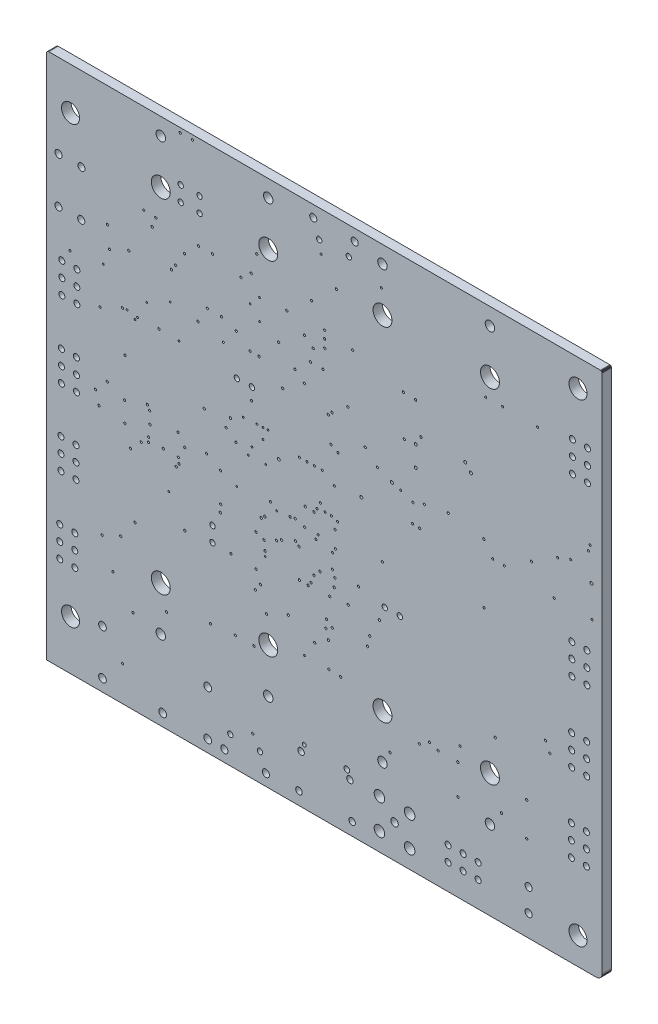
from build123d import *

# Parameters (mm, degrees)
BOARD_OUTLINE_DEPTH = 1.6
SKETCH2_R           = 0.325
SKETCH2_R_2         = 0.475
SKETCH2_R_3         = 1.6
SKETCH2_R_4         = 0.1905
SKETCH2_R_5         = 0.15
SKETCH2_R_6         = 0.175
SKETCH2_R_7         = 0.25
SKETCH2_R_8         = 1.524
SKETCH2_R_9         = 0.2
NPTH_DEPTH          = 131.561985758
SKETCH3_R           = 0.45
SKETCH3_R_2         = 0.6
SKETCH3_R_3         = 0.55
SKETCH3_R_4         = 0.635
SKETCH3_R_5         = 0.89
SKETCH3_R_6         = 0.8
SKETCH3_R_7         = 0.51
SKETCH3_R_8         = 0.455
SKETCH3_R_9         = 0.65
PTH_DEPTH           = 131.561985758


with BuildPart() as part:
    # Sketch1 → Board_Outline (new body)
    with BuildSketch(Plane.XY):
        Polygon((-94.885, 89.235556), (-94.885, 0.5), (-2.007153, 0.5), (-1.746483, 0.534318), (-1.503577, 0.634933), (-1.294988, 0.794988), (-1.134933, 1.003577), (-1.034318, 1.246483), (-1, 1.507153), (-1, 89.345834), (-1.011046, 89.429735), (-1.04343, 89.507917), (-1.094946, 89.575054), (-1.162083, 89.62657), (-1.240265, 89.658954), (-1.324166, 89.67), (-94.450556, 89.67), (-94.562999, 89.655197), (-94.667778, 89.611796), (-94.757754, 89.542754), (-94.826796, 89.452778), (-94.870197, 89.347999), align=None)
    extrude(amount=BOARD_OUTLINE_DEPTH)

    # Sketch2 → NPTH (cut, through all)
    with BuildSketch(Plane.XY):
        with Locations((-51.3266, 9.8552)):
            Circle(SKETCH2_R)
        with Locations((-44.1266, 9.8552)):
            Circle(SKETCH2_R_2)
        with Locations((-19.9502, 21.4054)):
            Circle(SKETCH2_R_3)
        with Locations((-38.1052, 21.4054)):
            Circle(SKETCH2_R_3)
        with Locations((-57.4052, 21.4054)):
            Circle(SKETCH2_R_3)
        with Locations((-19.9502, 79.3154)):
            Circle(SKETCH2_R_3)
        with Locations((-75.5602, 21.4054)):
            Circle(SKETCH2_R_3)
        with Locations((-75.5602, 79.3154)):
            Circle(SKETCH2_R_3)
        with Locations((-38.1052, 79.3154)):
            Circle(SKETCH2_R_3)
        with Locations((-57.4052, 79.3154)):
            Circle(SKETCH2_R_3)
        with Locations((-59.5884, 28.3718)):
            Circle(SKETCH2_R_4)
        with Locations((-31.877, 19.7104)):
            Circle(SKETCH2_R_4)
        with Locations((-46.5582, 37.8968)):
            Circle(SKETCH2_R_4)
        with Locations((-57.8104, 47.5991)):
            Circle(SKETCH2_R_5)
        with Locations((-49.1683, 45.466)):
            Circle(SKETCH2_R_4)
        with Locations((-38.9636, 56.6166)):
            Circle(SKETCH2_R_4)
        with Locations((-47.1678, 22.9616)):
            Circle(SKETCH2_R_4)
        with Locations((-47.5488, 30.099)):
            Circle(SKETCH2_R_4)
        with Locations((-36.83, 15.9512)):
            Circle(SKETCH2_R_4)
        with Locations((-46.8249, 56.0324)):
            Circle(SKETCH2_R_4)
        with Locations((-60.2742, 74.3458)):
            Circle(SKETCH2_R_4)
        with Locations((-55.6514, 66.5734)):
            Circle(SKETCH2_R_4)
        with Locations((-80.9752, 67.31)):
            Circle(SKETCH2_R_4)
        with Locations((-58.7069, 29.591)):
            Circle(SKETCH2_R_4)
        with Locations((-62.865, 48.3362)):
            Circle(SKETCH2_R_4)
        with Locations((-65.4812, 42.9006)):
            Circle(SKETCH2_R_4)
        with Locations((-55.9877, 41.7383)):
            Circle(SKETCH2_R_5)
        with Locations((-57.912, 34.0868)):
            Circle(SKETCH2_R_5)
        with Locations((-60.1472, 48.9924)):
            Circle(SKETCH2_R_5)
        with Locations((-61.6148, 52.609)):
            Circle(SKETCH2_R_5)
        with Locations((-17.8054, 76.073)):
            Circle(SKETCH2_R_6)
        with Locations((-78.4352, 74.4982)):
            Circle(SKETCH2_R_6)
        with Locations((-45.6184, 55.4228)):
            Circle(SKETCH2_R_6)
        with Locations((-36.5252, 55.626)):
            Circle(SKETCH2_R_7)
        with Locations((-55.626, 49.4792)):
            Circle(SKETCH2_R_7)
        with Locations((-13.7414, 14.8844)):
            Circle(SKETCH2_R_4)
        with Locations((-13.7414, 20.574)):
            Circle(SKETCH2_R_4)
        with Locations((-43.1419, 71.6788)):
            Circle(SKETCH2_R_4)
        with Locations((-19.05, 27.051)):
            Circle(SKETCH2_R_4)
        with Locations((-32.4866, 59.7916)):
            Circle(SKETCH2_R_7)
        with Locations((-48.6664, 36.5252)):
            Circle(SKETCH2_R_4)
        with Locations((-51.2499, 41.7249)):
            Circle(SKETCH2_R_4)
        with Locations((-54.9656, 60.1726)):
            Circle(SKETCH2_R_4)
        with Locations((-47.2694, 60.1726)):
            Circle(SKETCH2_R_4)
        with Locations((-49.3268, 40.894)):
            Circle(SKETCH2_R_6)
        with Locations((-46.5582, 40.3352)):
            Circle(SKETCH2_R_6)
        with Locations((-67.1576, 19.6342)):
            Circle(SKETCH2_R_4)
        with Locations((-49.5554, 25.654)):
            Circle(SKETCH2_R_4)
        with Locations((-46.5836, 29.3116)):
            Circle(SKETCH2_R_4)
        with Locations((-47.0154, 33.7058)):
            Circle(SKETCH2_R_4)
        with Locations((-49.6824, 35.4584)):
            Circle(SKETCH2_R_4)
        with Locations((-78.867, 40.3606)):
            Circle(SKETCH2_R_4)
        with Locations((-9.0932, 52.4256)):
            Circle(SKETCH2_R_6)
        with Locations((-2.7178, 52.451)):
            Circle(SKETCH2_R_6)
        with Locations((-72.4789, 40.3733)):
            Circle(SKETCH2_R_4)
        with Locations((-52.853, 42.1723)):
            Circle(SKETCH2_R_4)
        with Locations((-53.7083, 41.9989)):
            Circle(SKETCH2_R_4)
        with Locations((-72.9488, 39.7129)):
            Circle(SKETCH2_R_4)
        with Locations((-77.4087, 43.6702)):
            Circle(SKETCH2_R_4)
        with Locations((-86.0066, 42.1242)):
            Circle(SKETCH2_R_4)
        with Locations((-86.5976, 44.1802)):
            Circle(SKETCH2_R_4)
        with Locations((-75.8698, 58.42)):
            Circle(SKETCH2_R_4)
        with Locations((-73.0504, 69.1388)):
            Circle(SKETCH2_R_4)
        with Locations((-50.292, 66.3702)):
            Circle(SKETCH2_R_4)
        with Locations((-51.2826, 69.7738)):
            Circle(SKETCH2_R_4)
        with Locations((-80.6704, 38.5318)):
            Circle(SKETCH2_R_4)
        with Locations((-85.471, 23.4442)):
            Circle(SKETCH2_R_4)
        with Locations((-74.5998, 17.6276)):
            Circle(SKETCH2_R_4)
        with Locations((-24.9936, 22.8092)):
            Circle(SKETCH2_R_4)
        with Locations((-12.9286, 55.8546)):
            Circle(SKETCH2_R_4)
        with Locations((-27.0002, 55.9054)):
            Circle(SKETCH2_R_4)
        with Locations((-18.0086, 16.51)):
            Circle(SKETCH2_R_4)
        with Locations((-25.3492, 15.1892)):
            Circle(SKETCH2_R_4)
        with Locations((-57.9374, 34.8996)):
            Circle(SKETCH2_R_4)
        with Locations((-57.023, 42.545)):
            Circle(SKETCH2_R_4)
        with Locations((-52.1462, 33.528)):
            Circle(SKETCH2_R_4)
        with Locations((-43.8912, 34.036)):
            Circle(SKETCH2_R_4)
        with Locations((-40.259, 31.2928)):
            Circle(SKETCH2_R_4)
        with Locations((-40.64, 29.591)):
            Circle(SKETCH2_R_4)
        with Locations((-38.6334, 34.4424)):
            Circle(SKETCH2_R_4)
        with Locations((-42.1386, 37.592)):
            Circle(SKETCH2_R_4)
        with Locations((-65.4304, 37.973)):
            Circle(SKETCH2_R_4)
        with Locations((-65.5066, 36.7284)):
            Circle(SKETCH2_R_4)
        with Locations((-49.6697, 44.7294)):
            Circle(SKETCH2_R_4)
        with Locations((-60.0202, 7.1247)):
            Circle(SKETCH2_R_4)
        with Locations((-82.3214, 24.8412)):
            Circle(SKETCH2_R_4)
        with Locations((-81.5975, 51.7017)):
            Circle(SKETCH2_R_4)
        with Locations((-85.8139, 56.6293)):
            Circle(SKETCH2_R_4)
        with Locations((-85.2765, 63.1828)):
            Circle(SKETCH2_R_5)
        with Locations((-84.2264, 65.8876)):
            Circle(SKETCH2_R_4)
        with Locations((-69.1896, 73.9013)):
            Circle(SKETCH2_R_4)
        with Locations((-66.8274, 73.9013)):
            Circle(SKETCH2_R_4)
        with Locations((-67.691, 65.5066)):
            Circle(SKETCH2_R_4)
        with Locations((-65.3161, 65.4812)):
            Circle(SKETCH2_R_4)
        with Locations((-62.8142, 64.6303)):
            Circle(SKETCH2_R_4)
        with Locations((-60.4774, 62.865)):
            Circle(SKETCH2_R_4)
        with Locations((-58.9534, 62.8523)):
            Circle(SKETCH2_R_4)
        with Locations((-32.512, 69.723)):
            Circle(SKETCH2_R_4)
        with Locations((-34.5694, 69.8119)):
            Circle(SKETCH2_R_4)
        with Locations((-47.879, 70.9549)):
            Circle(SKETCH2_R_4)
        with Locations((-47.879, 72.2249)):
            Circle(SKETCH2_R_4)
        with Locations((-47.8536, 69.5833)):
            Circle(SKETCH2_R_4)
        with Locations((-49.8094, 68.6181)):
            Circle(SKETCH2_R_4)
        with Locations((-58.8899, 71.5137)):
            Circle(SKETCH2_R_5)
        with Locations((-58.8645, 67.9831)):
            Circle(SKETCH2_R_5)
        with Locations((-60.4647, 69.7992)):
            Circle(SKETCH2_R_5)
        with Locations((-59.3471, 77.6478)):
            Circle(SKETCH2_R_4)
        with Locations((-62.0268, 72.8853)):
            Circle(SKETCH2_R_4)
        with Locations((-41.021, 58.5343)):
            Circle(SKETCH2_R_4)
        with Locations((-52.8955, 64.008)):
            Circle(SKETCH2_R_4)
        with Locations((-51.308, 62.7253)):
            Circle(SKETCH2_R_4)
        with Locations((-67.818, 44.196)):
            Circle(SKETCH2_R_4)
        with Locations((-47.6758, 28.702)):
            Circle(SKETCH2_R_4)
        with Locations((-72.644, 44.9072)):
            Circle(SKETCH2_R_4)
        with Locations((-72.5932, 41.275)):
            Circle(SKETCH2_R_4)
        with Locations((-75.1332, 41.275)):
            Circle(SKETCH2_R_4)
        with Locations((-81.6864, 45.085)):
            Circle(SKETCH2_R_4)
        with Locations((-81.6356, 41.7068)):
            Circle(SKETCH2_R_4)
        with Locations((-76.4032, 74.422)):
            Circle(SKETCH2_R_4)
        with Locations((-45.8978, 79.2226)):
            Circle(SKETCH2_R_4)
        with Locations((-50.0888, 75.438)):
            Circle(SKETCH2_R_4)
        with Locations((-90.805, 82.55)):
            Circle(SKETCH2_R_8)
        with Locations((-90.805, 8.89)):
            Circle(SKETCH2_R_8)
        with Locations((-5.08, 5.08)):
            Circle(SKETCH2_R_8)
        with Locations((-5.08, 85.09)):
            Circle(SKETCH2_R_8)
        with Locations((-59.4614, 31.4706)):
            Circle(SKETCH2_R_4)
        with Locations((-63.7032, 31.5976)):
            Circle(SKETCH2_R_4)
        with Locations((-57.7088, 25.8064)):
            Circle(SKETCH2_R_4)
        with Locations((-54.0258, 27.4828)):
            Circle(SKETCH2_R_4)
        with Locations((-60.2234, 55.7276)):
            Circle(SKETCH2_R_4)
        with Locations((-63.8048, 51.4096)):
            Circle(SKETCH2_R_4)
        with Locations((-64.516, 49.6316)):
            Circle(SKETCH2_R_4)
        with Locations((-79.4849, 58.2847)):
            Circle(SKETCH2_R_5)
        with Locations((-81.2697, 58.5147)):
            Circle(SKETCH2_R_5)
        with Locations((-73.9648, 63.2968)):
            Circle(SKETCH2_R_5)
        with Locations((-74.1934, 35.4584)):
            Circle(SKETCH2_R_5)
        with Locations((-58.293, 51.0286)):
            Circle(SKETCH2_R_5)
        with Locations((-57.4548, 52.832)):
            Circle(SKETCH2_R_5)
        with Locations((-59.309, 52.7558)):
            Circle(SKETCH2_R_5)
        with Locations((-58.293, 52.7812)):
            Circle(SKETCH2_R_5)
        with Locations((-51.2826, 22.9362)):
            Circle(SKETCH2_R_5)
        with Locations((-60.7822, 47.498)):
            Circle(SKETCH2_R_5)
        with Locations((-62.7126, 41.9354)):
            Circle(SKETCH2_R_5)
        with Locations((-77.9272, 61.2394)):
            Circle(SKETCH2_R_5)
        with Locations((-72.2757, 88.9)):
            Circle(SKETCH2_R_4)
        with Locations((-70.2183, 88.9)):
            Circle(SKETCH2_R_4)
        with Locations((-48.4632, 83.0326)):
            Circle(SKETCH2_R_6)
        with Locations((-68.2244, 50.5714)):
            Circle(SKETCH2_R_9)
        with Locations((-3.0226, 63.2206)):
            Circle(SKETCH2_R_6)
        with Locations((-11.9126, 76.0222)):
            Circle(SKETCH2_R_6)
        with Locations((-2.794, 57.7342)):
            Circle(SKETCH2_R_7)
        with Locations((-32.4866, 63.2206)):
            Circle(SKETCH2_R_7)
        with Locations((-23.1648, 63.7032)):
            Circle(SKETCH2_R_7)
        with Locations((-41.6814, 50.8762)):
            Circle(SKETCH2_R_7)
        with Locations((-71.5518, 71.5772)):
            Circle(SKETCH2_R_4)
        with Locations((-69.2912, 62.7888)):
            Circle(SKETCH2_R_4)
        with Locations((-46.0502, 41.148)):
            Circle(SKETCH2_R_4)
        with Locations((-48.9712, 41.7322)):
            Circle(SKETCH2_R_6)
        with Locations((-45.6946, 45.3136)):
            Circle(SKETCH2_R_6)
        with Locations((-48.2854, 51.5366)):
            Circle(SKETCH2_R_6)
        with Locations((-46.736, 45.6438)):
            Circle(SKETCH2_R_6)
        with Locations((-49.6062, 51.5112)):
            Circle(SKETCH2_R_6)
        with Locations((-47.8028, 45.6692)):
            Circle(SKETCH2_R_6)
        with Locations((-50.8508, 51.4858)):
            Circle(SKETCH2_R_6)
        with Locations((-48.5902, 46.5836)):
            Circle(SKETCH2_R_6)
        with Locations((-52.1208, 51.4858)):
            Circle(SKETCH2_R_6)
        with Locations((-57.9882, 39.9034)):
            Circle(SKETCH2_R_4)
        with Locations((-77.8256, 46.355)):
            Circle(SKETCH2_R_4)
        with Locations((-58.5978, 39.3954)):
            Circle(SKETCH2_R_4)
        with Locations((-77.4446, 45.6692)):
            Circle(SKETCH2_R_4)
        with Locations((-55.1434, 37.8968)):
            Circle(SKETCH2_R_4)
        with Locations((-8.509, 58.6232)):
            Circle(SKETCH2_R_6)
        with Locations((-56.007, 37.4015)):
            Circle(SKETCH2_R_4)
        with Locations((-6.2992, 59.4614)):
            Circle(SKETCH2_R_6)
        with Locations((-59.4614, 36.9062)):
            Circle(SKETCH2_R_4)
        with Locations((-77.6371, 40.9448)):
            Circle(SKETCH2_R_4)
        with Locations((-58.1406, 36.3982)):
            Circle(SKETCH2_R_4)
        with Locations((-77.6224, 41.7068)):
            Circle(SKETCH2_R_4)
        with Locations((-46.1518, 36.8554)):
            Circle(SKETCH2_R_4)
        with Locations((-84.6074, 46.3296)):
            Circle(SKETCH2_R_4)
        with Locations((-79.9084, 57.7596)):
            Circle(SKETCH2_R_5)
        with Locations((-82.0166, 58.3946)):
            Circle(SKETCH2_R_4)
        with Locations((-38.3032, 83.2104)):
            Circle(SKETCH2_R_6)
        with Locations((-71.5137, 31.0896)):
            Circle(SKETCH2_R_4)
        with Locations((-46.2534, 35.4076)):
            Circle(SKETCH2_R_4)
        with Locations((-30.1752, 20.7899)):
            Circle(SKETCH2_R_4)
        with Locations((-28.702, 20.2946)):
            Circle(SKETCH2_R_4)
        with Locations((-25.3746, 20.2946)):
            Circle(SKETCH2_R_4)
        with Locations((-9.8298, 29.337)):
            Circle(SKETCH2_R_4)
        with Locations((-52.2224, 38.4175)):
            Circle(SKETCH2_R_4)
        with Locations((-52.8066, 38.9382)):
            Circle(SKETCH2_R_4)
        with Locations((-10.5664, 30.861)):
            Circle(SKETCH2_R_4)
        with Locations((-35.0266, 55.2196)):
            Circle(SKETCH2_R_6)
        with Locations((-46.1264, 43.942)):
            Circle(SKETCH2_R_6)
        with Locations((-33.02, 51.3334)):
            Circle(SKETCH2_R_4)
        with Locations((-32.9692, 54.4957)):
            Circle(SKETCH2_R_4)
        with Locations((-31.8262, 51.2572)):
            Circle(SKETCH2_R_4)
        with Locations((-31.0388, 55.1688)):
            Circle(SKETCH2_R_4)
        with Locations((-20.9804, 55.118)):
            Circle(SKETCH2_R_4)
        with Locations((-20.955, 45.085)):
            Circle(SKETCH2_R_4)
        with Locations((-38.1308, 43.2235)):
            Circle(SKETCH2_R_4)
        with Locations((-51.1603, 44.7929)):
            Circle(SKETCH2_R_4)
        with Locations((-20.6756, 75.9968)):
            Circle(SKETCH2_R_6)
        with Locations((-46.2534, 50.2666)):
            Circle(SKETCH2_R_6)
        with Locations((-19.4818, 52.959)):
            Circle(SKETCH2_R_6)
        with Locations((-17.526, 52.959)):
            Circle(SKETCH2_R_6)
        with Locations((-50.673, 33.5026)):
            Circle(SKETCH2_R_4)
        with Locations((-47.244, 27.2034)):
            Circle(SKETCH2_R_4)
        with Locations((-50.165, 34.1376)):
            Circle(SKETCH2_R_4)
        with Locations((-45.1739, 22.8473)):
            Circle(SKETCH2_R_4)
        with Locations((-82.0166, 6.3754)):
            Circle(SKETCH2_R_4)
        with Locations((-71.501, 43.2562)):
            Circle(SKETCH2_R_4)
        with Locations((-77.0128, 72.771)):
            Circle(SKETCH2_R_4)
        with Locations((-54.2798, 71.882)):
            Circle(SKETCH2_R_4)
        with Locations((-46.6344, 60.8076)):
            Circle(SKETCH2_R_4)
        with Locations((-31.5976, 64.7192)):
            Circle(SKETCH2_R_4)
        with Locations((-72.4916, 58.3438)):
            Circle(SKETCH2_R_5)
        with Locations((-3.3274, 62.23)):
            Circle(SKETCH2_R_6)
        with Locations((-24.13, 64.7954)):
            Circle(SKETCH2_R_7)
        with Locations((-84.582, 69.3166)):
            Circle(SKETCH2_R_4)
        with Locations((-62.9666, 20.0406)):
            Circle(SKETCH2_R_4)
        with Locations((-59.817, 20.0406)):
            Circle(SKETCH2_R_4)
        with Locations((-80.2386, 14.7066)):
            Circle(SKETCH2_R_4)
        with Locations((-83.6422, 18.9992)):
            Circle(SKETCH2_R_4)
        with Locations((-79.9084, 28.067)):
            Circle(SKETCH2_R_4)
        with Locations((-73.7616, 68.1482)):
            Circle(SKETCH2_R_4)
        with Locations((-48.1584, 66.3702)):
            Circle(SKETCH2_R_4)
        with Locations((-90.9066, 62.3316)):
            Circle(SKETCH2_R_4)
        with Locations((-43.9674, 62.9666)):
            Circle(SKETCH2_R_4)
        with Locations((-34.4297, 63.0047)):
            Circle(SKETCH2_R_4)
        with Locations((-64.9986, 61.9252)):
            Circle(SKETCH2_R_6)
    extrude(amount=NPTH_DEPTH, mode=Mode.SUBTRACT)

    # Sketch3 → PTH (cut, through all)
    with BuildSketch(Plane.XY):
        with Locations((-63.81, 5.14)):
            Circle(SKETCH3_R)
        with Locations((-58.81, 5.14)):
            Circle(SKETCH3_R)
        with Locations((-64.81, 2.44)):
            Circle(SKETCH3_R_2)
        with Locations((-57.81, 2.44)):
            Circle(SKETCH3_R_2)
        with Locations((-51.86, 8.61)):
            Circle(SKETCH3_R_3)
        with Locations((-43.6, 8.61)):
            Circle(SKETCH3_R_3)
        with Locations((-52.22, 2.66)):
            Circle(SKETCH3_R_3)
        with Locations((-43.24, 2.66)):
            Circle(SKETCH3_R_3)
        with Locations((-36.07, 6.13)):
            Circle(SKETCH3_R_4)
        with Locations((-38.62, 8.68)):
            Circle(SKETCH3_R_5)
        with Locations((-33.52, 8.68)):
            Circle(SKETCH3_R_5)
        with Locations((-33.52, 3.58)):
            Circle(SKETCH3_R_5)
        with Locations((-38.62, 3.58)):
            Circle(SKETCH3_R_5)
        with Locations((-19.95, 13.91)):
            Circle(SKETCH3_R_6)
        with Locations((-38.11, 13.91)):
            Circle(SKETCH3_R_6)
        with Locations((-57.41, 13.91)):
            Circle(SKETCH3_R_6)
        with Locations((-75.56, 13.91)):
            Circle(SKETCH3_R_6)
        with Locations((-75.56, 86.81)):
            Circle(SKETCH3_R_6)
        with Locations((-57.41, 86.81)):
            Circle(SKETCH3_R_6)
        with Locations((-38.11, 86.81)):
            Circle(SKETCH3_R_6)
        with Locations((-19.95, 86.81)):
            Circle(SKETCH3_R_6)
        with Locations((-92.28, 60.22)):
            Circle(SKETCH3_R_7)
        with Locations((-89.74, 60.22)):
            Circle(SKETCH3_R_7)
        with Locations((-92.28, 57.68)):
            Circle(SKETCH3_R_7)
        with Locations((-89.74, 57.68)):
            Circle(SKETCH3_R_7)
        with Locations((-92.28, 55.14)):
            Circle(SKETCH3_R_7)
        with Locations((-89.74, 55.14)):
            Circle(SKETCH3_R_7)
        with Locations((-92.35, 47.29)):
            Circle(SKETCH3_R_7)
        with Locations((-89.81, 47.29)):
            Circle(SKETCH3_R_7)
        with Locations((-92.35, 44.75)):
            Circle(SKETCH3_R_7)
        with Locations((-89.81, 44.75)):
            Circle(SKETCH3_R_7)
        with Locations((-92.35, 42.21)):
            Circle(SKETCH3_R_7)
        with Locations((-89.81, 42.21)):
            Circle(SKETCH3_R_7)
        with Locations((-3.58, 42.47)):
            Circle(SKETCH3_R_7)
        with Locations((-6.12, 42.47)):
            Circle(SKETCH3_R_7)
        with Locations((-3.58, 45.01)):
            Circle(SKETCH3_R_7)
        with Locations((-6.12, 45.01)):
            Circle(SKETCH3_R_7)
        with Locations((-3.58, 47.55)):
            Circle(SKETCH3_R_7)
        with Locations((-6.12, 47.55)):
            Circle(SKETCH3_R_7)
        with Locations((-3.61, 29.13)):
            Circle(SKETCH3_R_7)
        with Locations((-6.15, 29.13)):
            Circle(SKETCH3_R_7)
        with Locations((-3.61, 31.67)):
            Circle(SKETCH3_R_7)
        with Locations((-6.15, 31.67)):
            Circle(SKETCH3_R_7)
        with Locations((-3.61, 34.21)):
            Circle(SKETCH3_R_7)
        with Locations((-6.15, 34.21)):
            Circle(SKETCH3_R_7)
        with Locations((-92.43, 34.44)):
            Circle(SKETCH3_R_7)
        with Locations((-89.89, 34.44)):
            Circle(SKETCH3_R_7)
        with Locations((-92.43, 31.9)):
            Circle(SKETCH3_R_7)
        with Locations((-89.89, 31.9)):
            Circle(SKETCH3_R_7)
        with Locations((-92.43, 29.36)):
            Circle(SKETCH3_R_7)
        with Locations((-89.89, 29.36)):
            Circle(SKETCH3_R_7)
        with Locations((-92.63, 21.46)):
            Circle(SKETCH3_R_7)
        with Locations((-90.09, 21.46)):
            Circle(SKETCH3_R_7)
        with Locations((-92.63, 18.92)):
            Circle(SKETCH3_R_7)
        with Locations((-90.09, 18.92)):
            Circle(SKETCH3_R_7)
        with Locations((-92.63, 16.38)):
            Circle(SKETCH3_R_7)
        with Locations((-90.09, 16.38)):
            Circle(SKETCH3_R_7)
        with Locations((-27.03, 4.8)):
            Circle(SKETCH3_R_7)
        with Locations((-27.03, 7.34)):
            Circle(SKETCH3_R_7)
        with Locations((-24.49, 4.8)):
            Circle(SKETCH3_R_7)
        with Locations((-24.49, 7.34)):
            Circle(SKETCH3_R_7)
        with Locations((-21.95, 4.8)):
            Circle(SKETCH3_R_7)
        with Locations((-21.95, 7.34)):
            Circle(SKETCH3_R_7)
        with Locations((-3.66, 15.9)):
            Circle(SKETCH3_R_7)
        with Locations((-6.2, 15.9)):
            Circle(SKETCH3_R_7)
        with Locations((-3.66, 18.44)):
            Circle(SKETCH3_R_7)
        with Locations((-6.2, 18.44)):
            Circle(SKETCH3_R_7)
        with Locations((-3.66, 20.98)):
            Circle(SKETCH3_R_7)
        with Locations((-6.2, 20.98)):
            Circle(SKETCH3_R_7)
        with Locations((-92.83, 75.55)):
            Circle(SKETCH3_R_2)
        with Locations((-88.97, 75.55)):
            Circle(SKETCH3_R_2)
        with Locations((-89, 67.82)):
            Circle(SKETCH3_R_2)
        with Locations((-92.86, 67.82)):
            Circle(SKETCH3_R_2)
        with Locations((-13.42, 8.01)):
            Circle(SKETCH3_R_2)
        with Locations((-13.42, 4.15)):
            Circle(SKETCH3_R_2)
        with Locations((-43.8, 85.03)):
            Circle(SKETCH3_R)
        with Locations((-48.8, 85.03)):
            Circle(SKETCH3_R)
        with Locations((-42.8, 87.73)):
            Circle(SKETCH3_R_2)
        with Locations((-49.8, 87.73)):
            Circle(SKETCH3_R_2)
        with Locations((-3.48, 72.11)):
            Circle(SKETCH3_R_7)
        with Locations((-6.02, 72.11)):
            Circle(SKETCH3_R_7)
        with Locations((-3.48, 74.65)):
            Circle(SKETCH3_R_7)
        with Locations((-6.02, 74.65)):
            Circle(SKETCH3_R_7)
        with Locations((-3.48, 77.19)):
            Circle(SKETCH3_R_7)
        with Locations((-6.02, 77.19)):
            Circle(SKETCH3_R_7)
        with Locations((-66.83, 34.19)):
            Circle(SKETCH3_R_8)
        with Locations((-66.83, 31.65)):
            Circle(SKETCH3_R_8)
        with Locations((-37.72, 36.75)):
            Circle(SKETCH3_R_8)
        with Locations((-35.18, 36.75)):
            Circle(SKETCH3_R_8)
        with Locations((-69.01, 81.31)):
            Circle(SKETCH3_R_8)
        with Locations((-69.01, 78.77)):
            Circle(SKETCH3_R_8)
        with Locations((-72.2, 81.32)):
            Circle(SKETCH3_R_8)
        with Locations((-72.2, 78.78)):
            Circle(SKETCH3_R_8)
        with Locations((-60.17, 57.76)):
            Circle(SKETCH3_R_8)
        with Locations((-62.71, 57.76)):
            Circle(SKETCH3_R_8)
        with Locations((-85.41, 2.54)):
            Circle(SKETCH3_R_9)
        with Locations((-85.41, 10.16)):
            Circle(SKETCH3_R_9)
        with Locations((-75.25, 2.54)):
            Circle(SKETCH3_R_9)
        with Locations((-67.63, 10.16)):
            Circle(SKETCH3_R_9)
        with Locations((-67.63, 2.54)):
            Circle(SKETCH3_R_9)
    extrude(amount=PTH_DEPTH, mode=Mode.SUBTRACT)


solid = part.part
